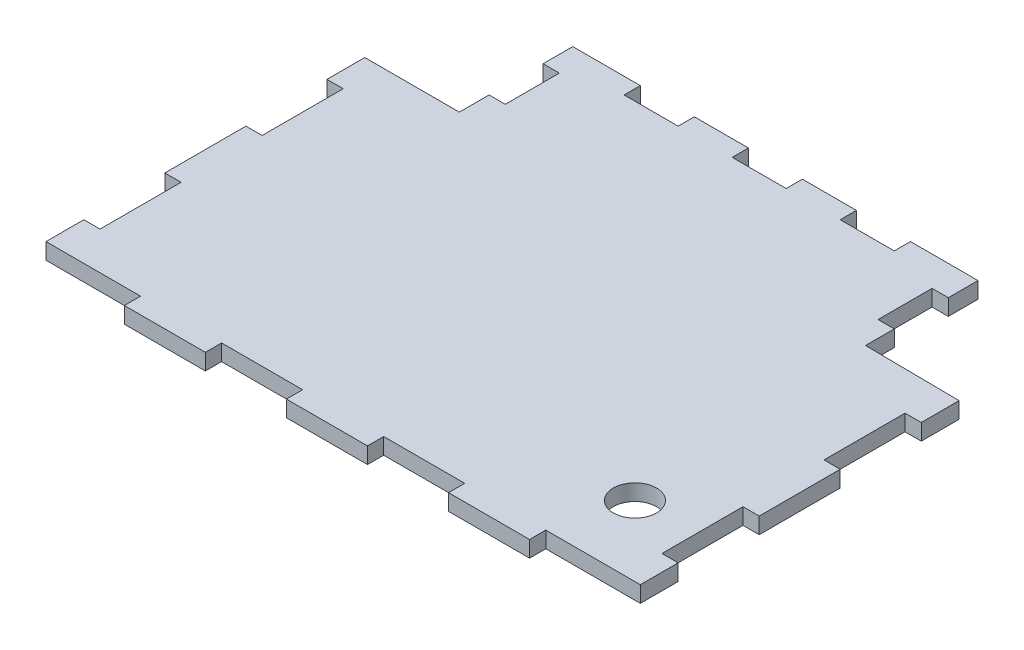
from build123d import *

# Parameters (mm, degrees)
SALIENTE_EXTRUIR1_DEPTH = 3
SKETCH1_R               = 4
CUT_EXTRUDE1_DEPTH      = 10


with BuildPart() as part:
    # Croquis1 → Saliente-Extruir1 (new body)
    with BuildSketch(Plane(origin=(0, 0, 0), x_dir=(1, 0, 0), z_dir=(0, 1, 0))):
        Polygon((0, 10), (0, 3), (17.5, 3), (17.5, 0), (32.5, 0), (32.5, 3), (47.5, 3), (47.5, 0), (55, 0), (62.5, 0), (62.5, 3), (77.5, 3), (77.5, 0), (92.5, 0), (92.5, 3), (110, 3), (110, 10), (107, 10), (107, 25), (110, 25), (110, 32.5), (110, 40), (107, 40), (107, 55), (110, 55), (110, 62), (92.5, 62.187777448), (92.5, 67.5), (89.5, 67.5), (89.5, 72.5), (89.5, 77.5), (92.5, 77.5), (92.5, 83), (80, 83), (80, 80), (70, 80), (70, 83), (60, 83), (60, 80), (50, 80), (50, 83), (40, 83), (40, 80), (30, 80), (30, 83), (17.5, 83), (17.5, 77.5), (20.5, 77.5), (20.5, 72.5), (20.5, 67.5), (17.5, 67.5), (17.5, 62), (0, 62), (0, 55), (3, 55), (3, 40), (0, 40), (0, 25), (3, 25), (3, 10), align=None)
    extrude(amount=SALIENTE_EXTRUIR1_DEPTH)

    # Sketch1 → Cut-Extrude1 (cut)
    with BuildSketch(Plane(origin=(0, 3, 0), x_dir=(1, 0, 0), z_dir=(0, 1, 0))):
        with Locations((96, 16)):
            Circle(SKETCH1_R)
    extrude(amount=-CUT_EXTRUDE1_DEPTH, mode=Mode.SUBTRACT)


solid = part.part
